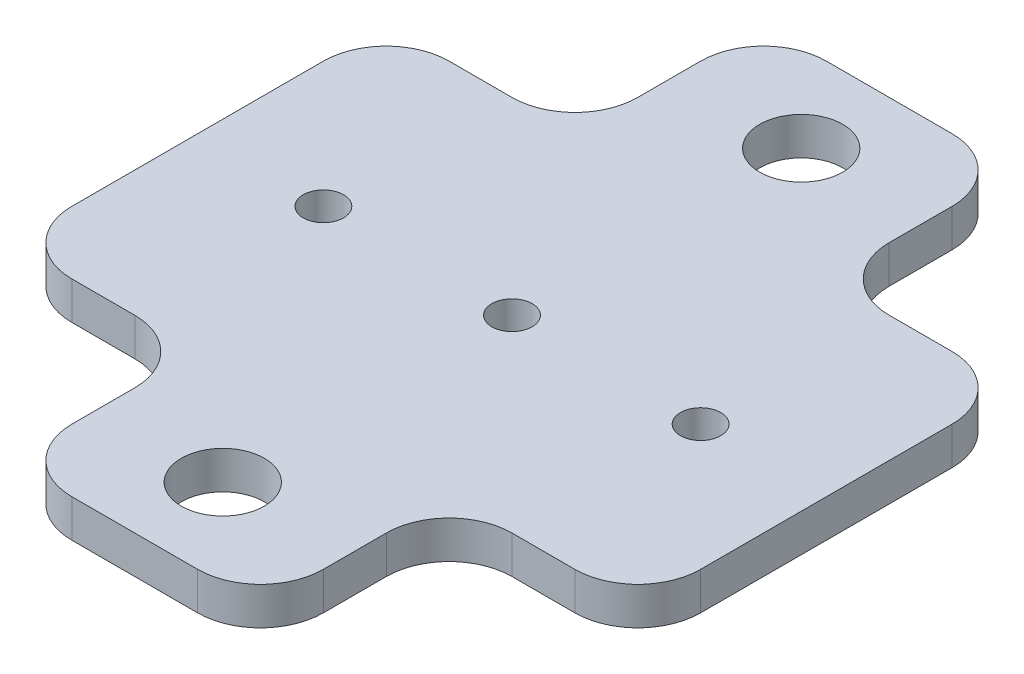
from build123d import *

# Parameters (mm, degrees)
EXTRUDE_1_DEPTH     = 3
FILLET_1_R          = 5
SKETCH_2_R          = 1.6
CUT_EXTRUDE_1_DEPTH = 10
SKETCH_3_R          = 3.3
CUT_EXTRUDE_2_DEPTH = 10


with BuildPart() as part:
    # 草图1 → 凸台-拉伸1 (new body)
    with BuildSketch(Plane(origin=(0, 0, 0), x_dir=(1, 0, 0), z_dir=(0, 1, 0))):
        Polygon((10, 15), (25, 15), (25, -15), (10, -15), (10, -30), (-10, -30), (-10, -15), (-25, -15), (-25, 15), (-10, 15), (-10, 30), (10, 30), align=None)
    extrude(amount=EXTRUDE_1_DEPTH)

    # 圆角1
    fillet_1_edges = [part.edges().sort_by_distance(p)[0] for p in [
        (-25, 1.5, 15),
        (-10, 1.5, 15),
        (-10, 1.5, 30),
        (10, 1.5, 30),
        (10, 1.5, 15),
        (25, 1.5, 15),
        (25, 1.5, -15),
        (-25, 1.5, -15),
        (-10, 1.5, -15),
        (10, 1.5, -15),
        (10, 1.5, -30),
        (-10, 1.5, -30),
    ]]
    fillet(fillet_1_edges, radius=FILLET_1_R)

    # 草图2 → 切除-拉伸1 (cut)
    with BuildSketch(Plane(origin=(0, 3, 0), x_dir=(1, 0, 0), z_dir=(0, 1, 0))):
        with Locations((15, 0)):
            Circle(SKETCH_2_R)
        Circle(SKETCH_2_R)
        with Locations((-15, 0)):
            Circle(SKETCH_2_R)
    extrude(amount=-CUT_EXTRUDE_1_DEPTH, mode=Mode.SUBTRACT)

    # 草图3 → 切除-拉伸2 (cut)
    with BuildSketch(Plane(origin=(0, 3, 0), x_dir=(1, 0, 0), z_dir=(0, 1, 0))):
        with Locations((0, -23)):
            Circle(SKETCH_3_R)
        with Locations((0, 23)):
            Circle(SKETCH_3_R)
    extrude(amount=-CUT_EXTRUDE_2_DEPTH, mode=Mode.SUBTRACT)


solid = part.part
